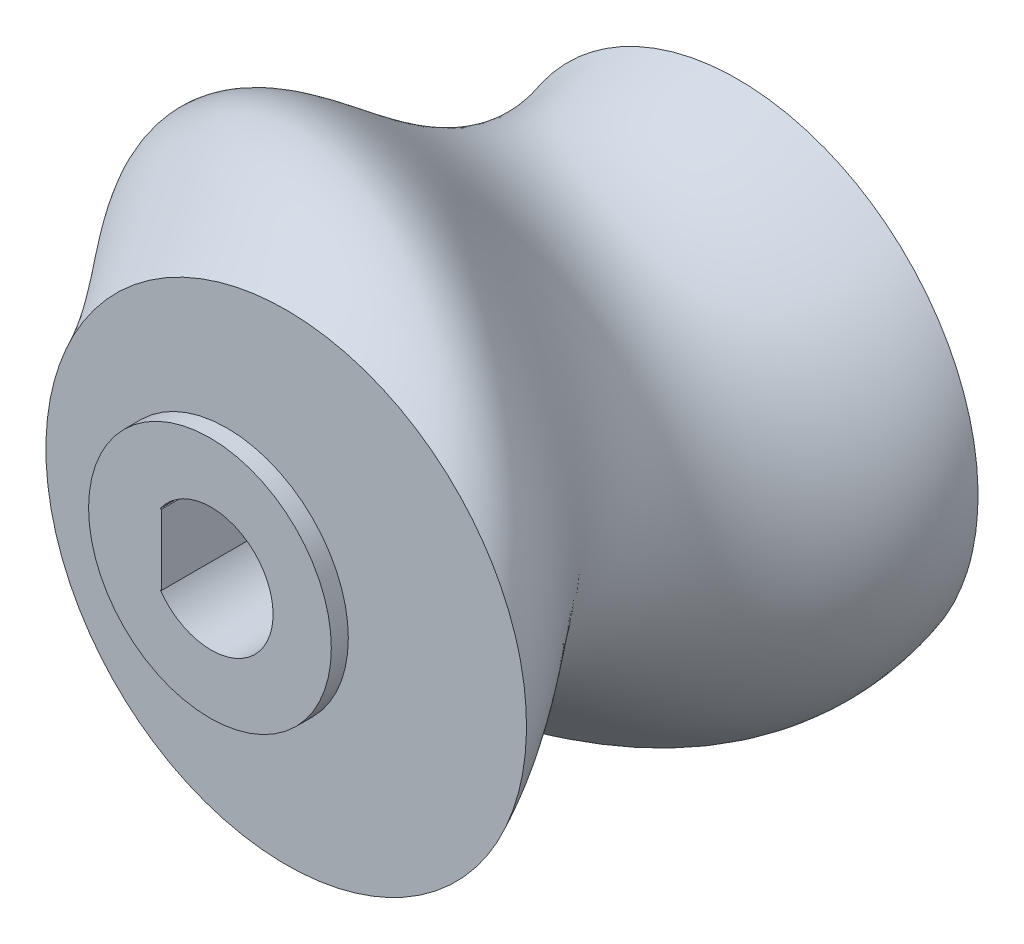
from build123d import *

# Parameters (mm, degrees)
AUSTRAGUNG1_PITCH               = 20
AUSTRAGUNG1_HEIGHT              = 20
AUSTRAGUNG1_RADIUS              = 2.55
SKIZZE2_R                       = 9.89957
SKIZZE3_2_R                     = 2.55
SCHNITT_LINEAR_AUSTRAGEN2_DEPTH = 27
SKIZZE6_R                       = 12.742889142
SKIZZE6_R_2                     = 5
SCHNITT_LINEAR_AUSTRAGEN3_DEPTH = 0.7
SCHNITT_LINEAR_START            = -0.7
SKIZZE7_R                       = 13.024497883
SKIZZE7_R_2                     = 5
SCHNITT_LINEAR_AUSTRAGEN4_DEPTH = 0.7
SKIZZE8_W                       = 1
SKIZZE8_H                       = 2.897126602
AUFSATZ_LINEAR_AUSTRAGEN1_DEPTH = 20


with BuildPart() as part:
    # Austragung1: sweep along a helix
    with BuildLine() as austragung1_path:
        Helix(AUSTRAGUNG1_PITCH, AUSTRAGUNG1_HEIGHT, AUSTRAGUNG1_RADIUS, center=(-2.45, 0, 0), direction=(0, 0, 1), lefthand=True)
    # Skizze2 → Austragung1 (sweep)
    with BuildSketch(Plane.XY):
        Circle(SKIZZE2_R)
    sweep(path=austragung1_path.line, is_frenet=True)

    # Skizze3<2> → Schnitt-Linear austragen2 (cut)
    with BuildSketch(Plane.XY):
        with Locations(Location((-2.45, 0, 0), (0, 0, 180))):
            Circle(SKIZZE3_2_R)
    extrude(amount=SCHNITT_LINEAR_AUSTRAGEN2_DEPTH, mode=Mode.SUBTRACT)

    # Skizze6 → Schnitt-Linear austragen3 (cut)
    with BuildSketch(Plane.XY.offset(20)):
        with Locations((-2.5, 0)):
            Circle(SKIZZE6_R)
        with Locations((-2.5, 0)):
            Circle(SKIZZE6_R_2, mode=Mode.SUBTRACT)
    extrude(amount=-SCHNITT_LINEAR_AUSTRAGEN3_DEPTH, mode=Mode.SUBTRACT)

    # Skizze7 → Schnitt-Linear austragen4 (cut)
    with BuildSketch(Plane(origin=(0, 0, 0), x_dir=(-1, 0, 0), z_dir=(0, 0, -1)).offset(SCHNITT_LINEAR_START)):
        with Locations((2.5, 0)):
            Circle(SKIZZE7_R)
        with Locations(Location((2.5, 0, 0), (0, 0, 180))):
            Circle(SKIZZE7_R_2, mode=Mode.SUBTRACT)
    extrude(amount=SCHNITT_LINEAR_AUSTRAGEN4_DEPTH, mode=Mode.SUBTRACT)

    # Skizze8 → Aufsatz-Linear austragen1 (add)
    with BuildSketch(Plane(origin=(0, 0, 0), x_dir=(-1, 0, 0), z_dir=(0, 0, -1))):
        with Locations((5, 0)):
            Rectangle(SKIZZE8_W, SKIZZE8_H)
    extrude(amount=-AUFSATZ_LINEAR_AUSTRAGEN1_DEPTH)


solid = part.part
